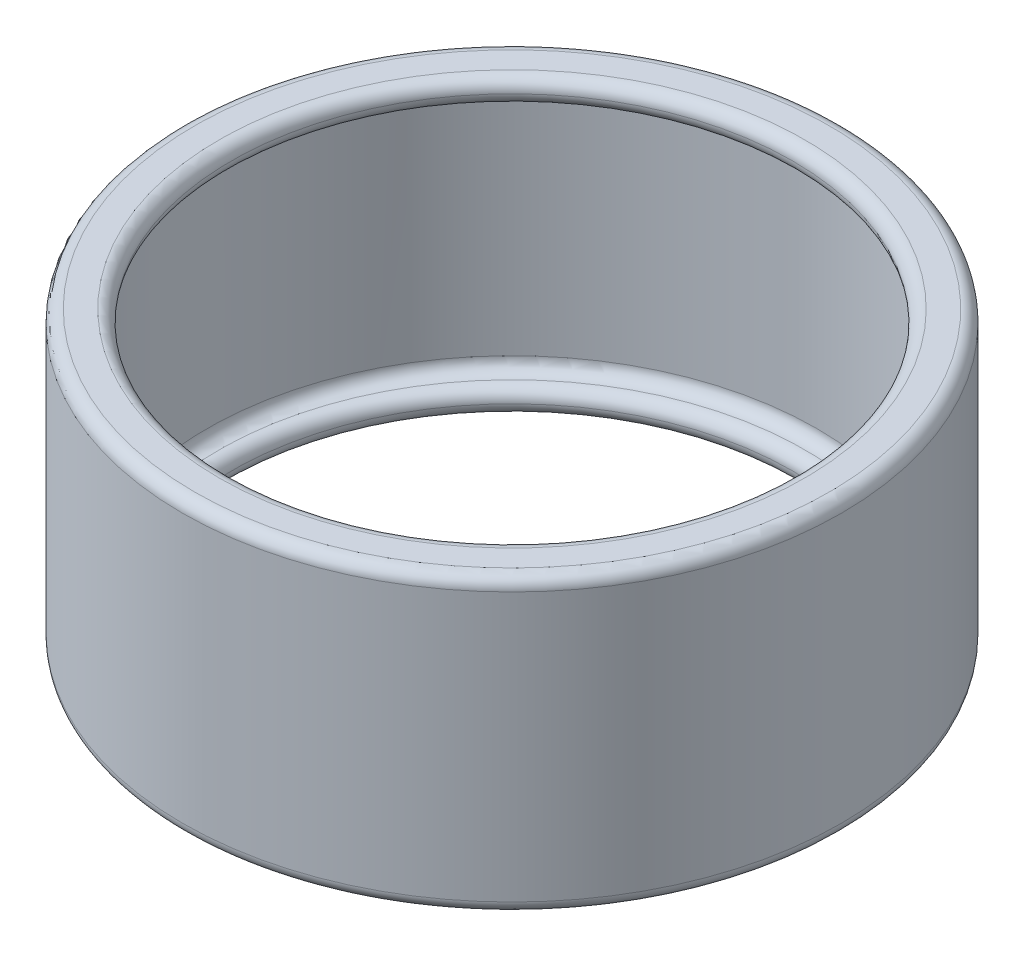
from build123d import *

# Parameters (mm, degrees)
FILLET1_R = 1


with BuildPart() as part:
    # Sketch3 → Revolve1 (revolve)
    with BuildSketch(Plane.XY, mode=Mode.PRIVATE) as revolve1_sk:
        Polygon((27, -12), (27, 12), (23, 12), (23, 10), (25, 10), (25, -10), (23, -10), (23, -12), align=None)
    revolve(revolve1_sk.sketch.rotate(Axis((0, 0, 0), (0, 1, 0)), 90), axis=Axis((0, 0, 0), (0, 1, 0)))

    # Fillet1
    fillet1_edges = [part.edges().sort_by_distance(p)[0] for p in [
        (0, 12, 23),
        (0, 12, 27),
        (0, -12, 27),
        (0, -12, 23),
        (0, -10, 23),
        (0, -10, 25),
        (0, 10, 23),
    ]]
    fillet(fillet1_edges, radius=FILLET1_R - 0.0001)  # a hair under: the kernel refuses the full size


solid = part.part
